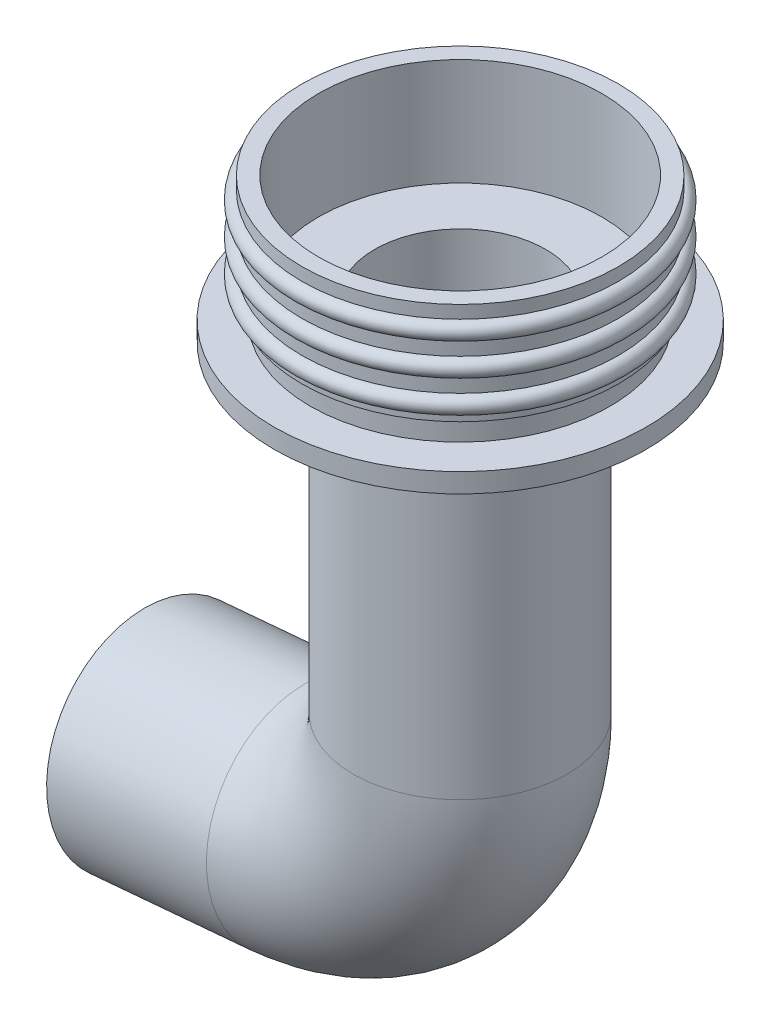
from build123d import *

# Parameters (mm, degrees)
SKETCH1_R           = 17.4
BOSS_EXTRUDE1_DEPTH = 1.81
SKETCH2_R           = 14.02
BOSS_EXTRUDE2_DEPTH = 2.2
SKETCH5_R           = 14.8
BOSS_EXTRUDE3_DEPTH = 9.5
SKETCH6_R           = 13.25
CUT_EXTRUDE1_DEPTH  = 10
SKETCH7_R           = 8
CUT_EXTRUDE2_DEPTH  = 27.561626456
SKETCH10_R          = 10
SKETCH10_R_2        = 8


with BuildPart() as part:
    # Sketch1 → Boss-Extrude1 (new body)
    with BuildSketch(Plane(origin=(0, 0, 0), x_dir=(1, 0, 0), z_dir=(0, 1, 0))):
        Circle(SKETCH1_R)
    extrude(amount=BOSS_EXTRUDE1_DEPTH)

    # Sketch2 → Boss-Extrude2 (add)
    with BuildSketch(Plane(origin=(0, 1.81, 0), x_dir=(1, 0, 0), z_dir=(0, 1, 0))):
        Circle(SKETCH2_R)
    extrude(amount=BOSS_EXTRUDE2_DEPTH)

    # Sketch5 → Boss-Extrude3 (add)
    with BuildSketch(Plane(origin=(0, 4.01, 0), x_dir=(1, 0, 0), z_dir=(0, 1, 0))):
        Circle(SKETCH5_R)
    extrude(amount=BOSS_EXTRUDE3_DEPTH)

    # Sketch6 → Cut-Extrude1 (cut)
    with BuildSketch(Plane(origin=(0, 13.51, 0), x_dir=(1, 0, 0), z_dir=(0, 1, 0))):
        Circle(SKETCH6_R)
    extrude(amount=-CUT_EXTRUDE1_DEPTH, mode=Mode.SUBTRACT)

    # Sketch7 → Cut-Extrude2 (cut, through all)
    with BuildSketch(Plane(origin=(0, 3.51, 0), x_dir=(1, 0, 0), z_dir=(0, 1, 0))):
        Circle(SKETCH7_R)
    extrude(amount=-CUT_EXTRUDE2_DEPTH, mode=Mode.SUBTRACT)

    # Sketch8 → Revolve1 (revolve)
    with BuildSketch(Plane(origin=(0, 0, 0), x_dir=(0, 0, -1), z_dir=(1, 0, 0))):
        with BuildLine():
            Line((-14.8, 12.31), (-14.8, 10.71))
            ThreePointArc((-14.8, 10.71), (-15.6, 11.51), (-14.8, 12.31))
        make_face()
        with BuildLine():
            Line((-14.8, 7.71), (-14.8, 9.31))
            ThreePointArc((-14.8, 9.31), (-15.6, 8.51), (-14.8, 7.71))
        make_face()
        with BuildLine():
            Line((-14.8, 4.71), (-14.8, 6.31))
            ThreePointArc((-14.8, 6.31), (-15.6, 5.51), (-14.8, 4.71))
        make_face()
    revolve(axis=Axis((0, 3.51, 0), (0, 1, 0)))

    # Sweep1: sweep along a path in Sketch9
    with BuildLine(Plane.XY) as sweep1_path:
        Line((0, 0), (0, -30))
        ThreePointArc((0, -30), (-3.940839948, -40.133853114), (-13.692663859, -44.942920471))
        Line((-13.692663859, -44.942920471), (-28.63558433, -46.250256613))
    # Sketch10 → Sweep1 (sweep)
    with BuildSketch(Plane.XZ):
        Circle(SKETCH10_R)
        Circle(SKETCH10_R_2, mode=Mode.SUBTRACT)
    sweep(path=sweep1_path.line)


solid = part.part
